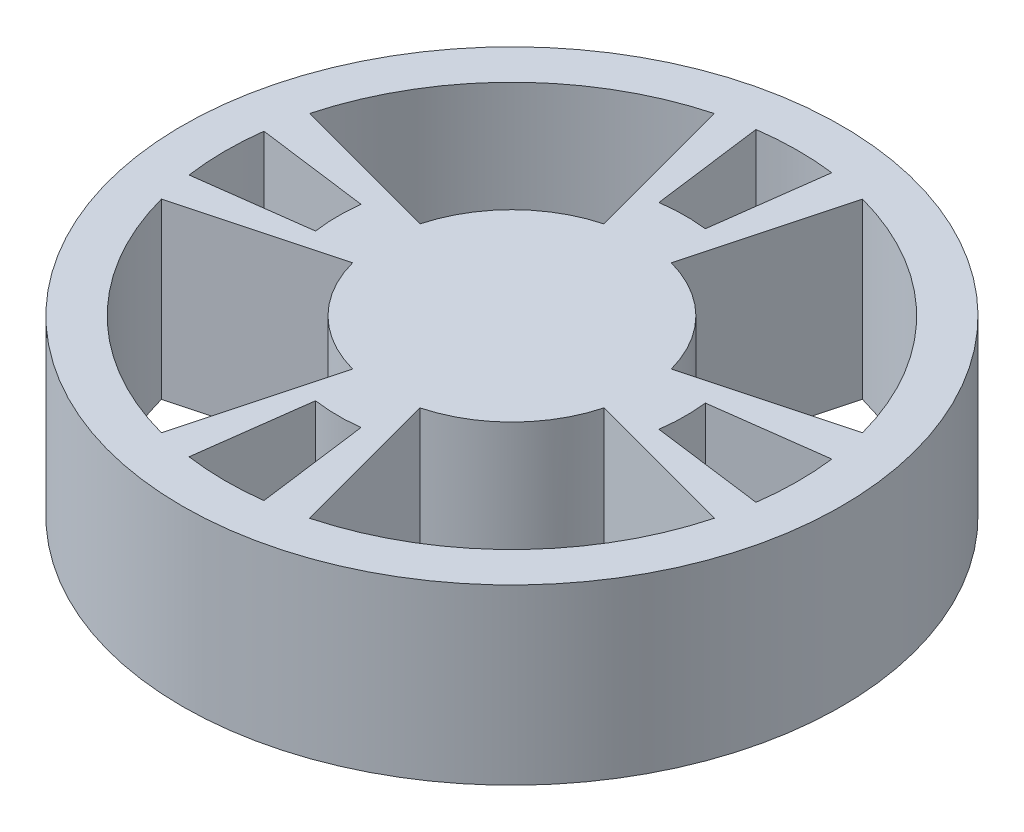
from build123d import *
from build123d.topology import SkipClean

# Parameters (mm, degrees)
SKETCH1_R           = 9.525
BOSS_EXTRUDE1_DEPTH = 2.54
SKETCH3_R           = 24.13
BOSS_EXTRUDE2_DEPTH = 12.7
CUT_EXTRUDE2_DEPTH  = 38.373404983
CUT_EXTRUDE3_DEPTH  = 8.466666667


with BuildPart() as part:
    # Sketch1 → Boss-Extrude1 (new body)
    with BuildSketch(Plane(origin=(0, 0, 0), x_dir=(1, 0, 0), z_dir=(0, 1, 0))):
        Circle(SKETCH1_R)
    extrude(amount=BOSS_EXTRUDE1_DEPTH)

    # Sketch3 → Boss-Extrude2 (add)
    with SkipClean():  # the faces are left unmerged after this step: merging them gives an invalid solid
        with BuildSketch(Plane(origin=(0, 2.54, 0), x_dir=(1, 0, 0), z_dir=(0, 1, 0))):
            Circle(SKETCH3_R)
            with BuildLine():
                Line((-2.465251405, 9.200443495), (-5.42355309, 20.24097569))
                ThreePointArc((-5.42355309, 20.24097569), (-14.8174226, 14.8174226), (-20.24097569, 5.42355309))
                Line((-20.24097569, 5.42355309), (-9.200443495, 2.465251405))
                ThreePointArc((-9.200443495, 2.465251405), (-6.735192091, 6.735192091), (-2.465251405, 9.200443495))
            make_face(mode=Mode.SUBTRACT)
            with BuildLine():
                Line((9.200443495, 2.465251405), (20.24097569, 5.42355309))
                ThreePointArc((20.24097569, 5.42355309), (14.8174226, 14.8174226), (5.42355309, 20.24097569))
                Line((5.42355309, 20.24097569), (2.465251405, 9.200443495))
                ThreePointArc((2.465251405, 9.200443495), (6.735192091, 6.735192091), (9.200443495, 2.465251405))
            make_face(mode=Mode.SUBTRACT)
            with BuildLine():
                Line((9.200443495, -2.465251405), (20.24097569, -5.42355309))
                ThreePointArc((20.24097569, -5.42355309), (14.8174226, -14.8174226), (5.42355309, -20.24097569))
                Line((5.42355309, -20.24097569), (2.465251405, -9.200443495))
                ThreePointArc((2.465251405, -9.200443495), (6.735192091, -6.735192091), (9.200443495, -2.465251405))
            make_face(mode=Mode.SUBTRACT)
            with BuildLine():
                Line((-9.200443495, -2.465251405), (-20.24097569, -5.42355309))
                ThreePointArc((-20.24097569, -5.42355309), (-14.8174226, -14.8174226), (-5.42355309, -20.24097569))
                Line((-5.42355309, -20.24097569), (-2.465251405, -9.200443495))
                ThreePointArc((-2.465251405, -9.200443495), (-6.735192091, -6.735192091), (-9.200443495, -2.465251405))
            make_face(mode=Mode.SUBTRACT)
        extrude(amount=BOSS_EXTRUDE2_DEPTH)

    # Sketch4 → Cut-Extrude2 (cut, through all)
    with SkipClean():  # the faces are left unmerged after this step: merging them gives an invalid solid
        with BuildSketch(Plane(origin=(0, 15.24, 0), x_dir=(1, 0, 0), z_dir=(0, 1, 0))):
            with BuildLine():
                Line((12.604555768, 1.554082971), (20.78910082, 2.631598769))
                ThreePointArc((20.78910082, 2.631598769), (20.95460619, -0.128469511), (20.755271414, -2.886301011))
                Line((20.755271414, -2.886301011), (12.570536445, -1.80876021))
                ThreePointArc((12.570536445, -1.80876021), (12.699350202, -0.128469656), (12.604555768, 1.554082971))
            make_face()
            with BuildLine():
                Line((-12.604555768, 1.554082971), (-20.78910082, 2.631598769))
                ThreePointArc((-20.78910082, 2.631598769), (-20.95460619, -0.128469511), (-20.755271414, -2.886301011))
                Line((-20.755271414, -2.886301011), (-12.570536445, -1.80876021))
                ThreePointArc((-12.570536445, -1.80876021), (-12.699350202, -0.128469656), (-12.604555768, 1.554082971))
            make_face()
            with BuildLine():
                Line((1.554082971, 12.604555768), (2.631598769, 20.78910082))
                ThreePointArc((2.631598769, 20.78910082), (-0.128469511, 20.95460619), (-2.886301011, 20.755271414))
                Line((-2.886301011, 20.755271414), (-1.80876021, 12.570536445))
                ThreePointArc((-1.80876021, 12.570536445), (-0.128469656, 12.699350202), (1.554082971, 12.604555768))
            make_face()
            with BuildLine():
                Line((-1.80876021, -12.570536445), (-2.886301011, -20.755271414))
                ThreePointArc((-2.886301011, -20.755271414), (-0.128469511, -20.95460619), (2.631598769, -20.78910082))
                Line((2.631598769, -20.78910082), (1.554082971, -12.604555768))
                ThreePointArc((1.554082971, -12.604555768), (-0.128469656, -12.699350202), (-1.80876021, -12.570536445))
            make_face()
        extrude(amount=-CUT_EXTRUDE2_DEPTH, mode=Mode.SUBTRACT)

    # Sketch2 → Cut-Extrude3 (cut)
    with SkipClean():  # the faces are left unmerged after this step: merging them gives an invalid solid
        with BuildSketch(Plane(origin=(0, 0, 0), x_dir=(1, 0, 0), z_dir=(0, 1, 0))):
            Polygon((-4.552853785, 1.885853785), (-1.885853785, 4.552853785), (0, 2.667), (1.885853785, 4.552853785), (4.552853785, 1.885853785), (2.667, 0), (4.552853785, -1.885853785), (1.885853785, -4.552853785), (0, -2.667), (-1.885853785, -4.552853785), (-4.552853785, -1.885853785), (-2.667, 0), align=None)
        extrude(amount=CUT_EXTRUDE3_DEPTH, mode=Mode.SUBTRACT)


solid = part.part
